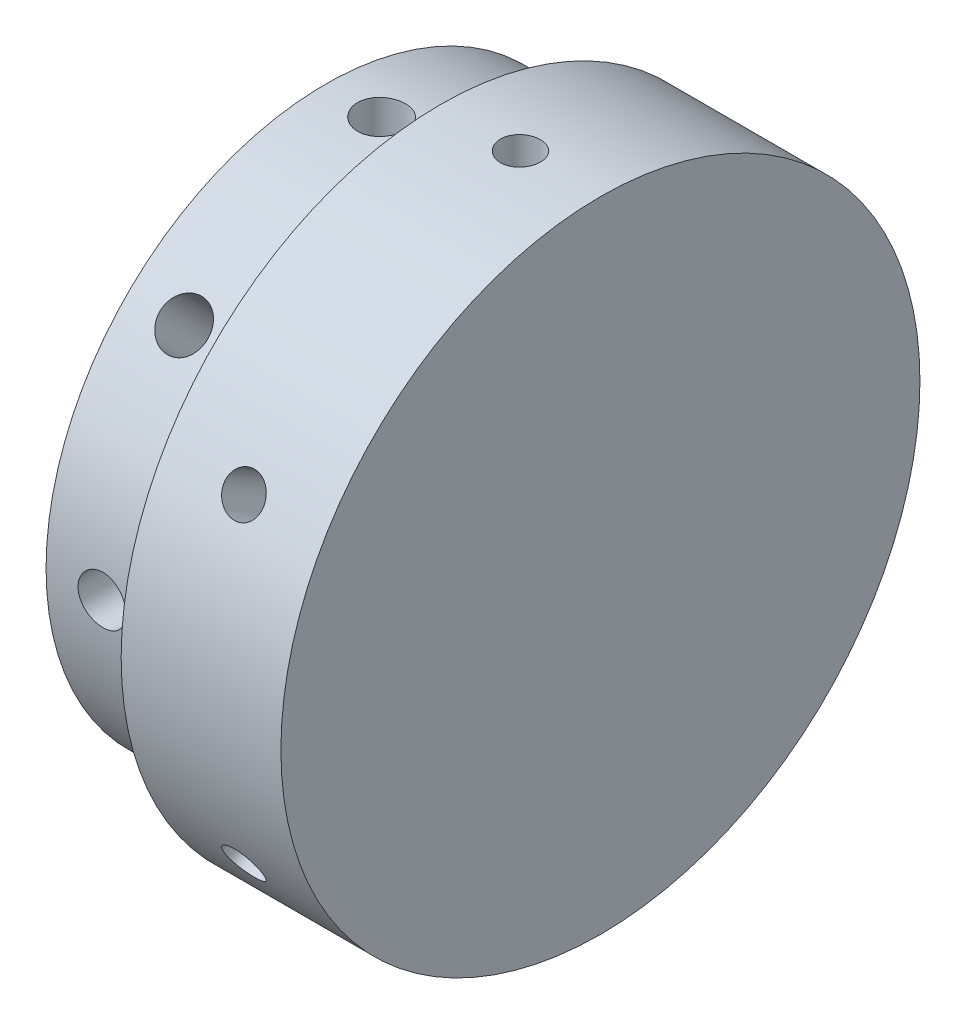
from build123d import *

# Parameters (mm, degrees)
SKETCH1_R           = 40
BOSS_EXTRUDE2_DEPTH = 10
SKETCH4_R           = 2.5
CUT_EXTRUDE3_DEPTH  = 15.4
CIRPATTERN1_COUNT   = 6
SKETCH3_R           = 35
BOSS_EXTRUDE4_DEPTH = 14.4
SKETCH8_R           = 3
CUT_EXTRUDE4_DEPTH  = 10
CIRPATTERN2_COUNT   = 8


with BuildPart() as part:
    # Sketch1 → Boss-Extrude2 (new, symmetric)
    with BuildSketch(Plane(origin=(0, 0, 0), x_dir=(0, 0, -1), z_dir=(1, 0, 0))):
        Circle(SKETCH1_R)
    extrude(amount=BOSS_EXTRUDE2_DEPTH, both=True)

    # Sketch4 → Cut-Extrude3 (cut)
    with BuildSketch(Plane(origin=(0, 40, 0), x_dir=(1, 0, 0), z_dir=(0, 1, 0))):
        Circle(SKETCH4_R)
    cut_extrude3 = extrude(amount=-CUT_EXTRUDE3_DEPTH, mode=Mode.SUBTRACT)

    # CirPattern1: Cut-Extrude3 ×6 about axis
    cirpattern1_axis = Axis((-10, 0, 0), (1, 0, 0))
    for i in range(1, CIRPATTERN1_COUNT):
        add(cut_extrude3.rotate(cirpattern1_axis, i * 360 / CIRPATTERN1_COUNT), mode=Mode.SUBTRACT)

    # Sketch3 → Boss-Extrude4 (add)
    with BuildSketch(Plane.ZY.offset(10)):
        Circle(SKETCH3_R)
    extrude(amount=BOSS_EXTRUDE4_DEPTH)

    # Sketch8 → Cut-Extrude4 (cut)
    with BuildSketch(Plane(origin=(0, 35, 0), x_dir=(1, 0, 0), z_dir=(0, 1, 0))):
        with Locations((-17.4, 0)):
            Circle(SKETCH8_R)
    cut_extrude4 = extrude(amount=-CUT_EXTRUDE4_DEPTH, mode=Mode.SUBTRACT)

    # CirPattern2: Cut-Extrude4 ×8 about axis
    cirpattern2_axis = Axis((-24.4, 0, 0), (-1, 0, 0))
    for i in range(1, CIRPATTERN2_COUNT):
        add(cut_extrude4.rotate(cirpattern2_axis, i * 360 / CIRPATTERN2_COUNT), mode=Mode.SUBTRACT)


solid = part.part
